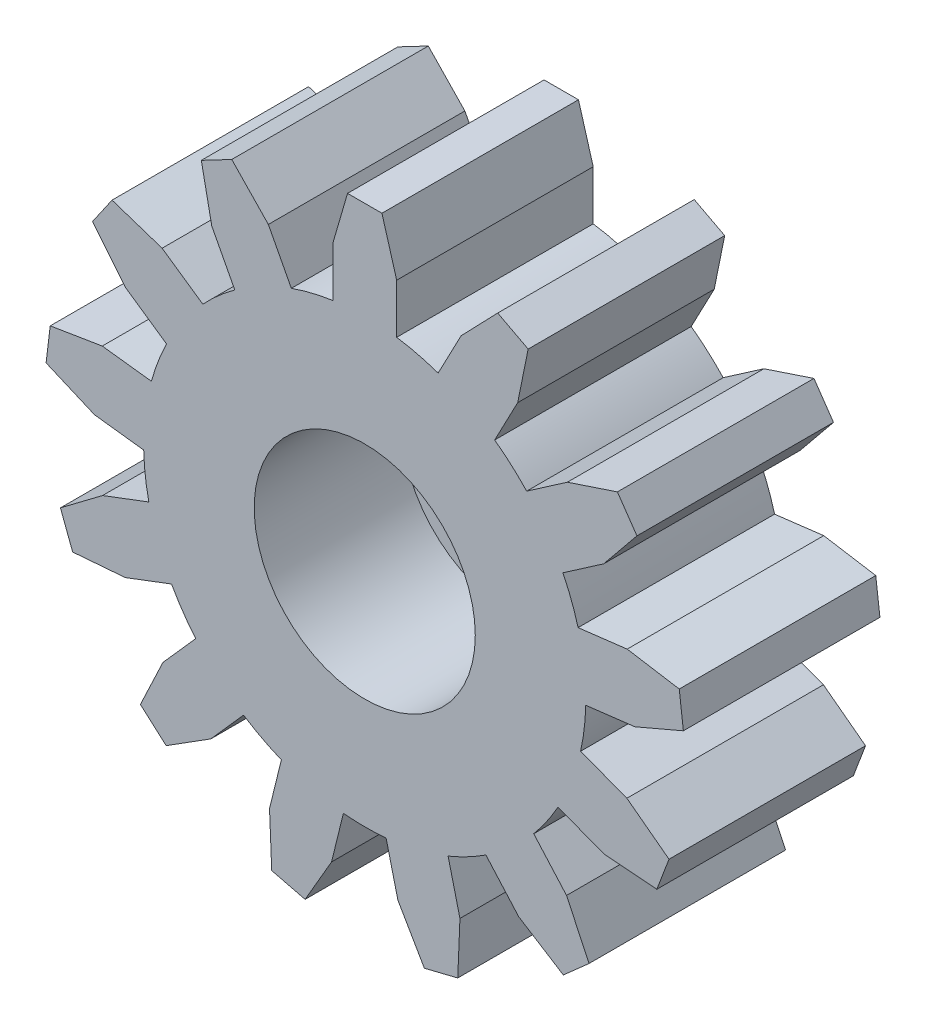
from build123d import *

# Parameters (mm, degrees)
SZKIC1_R                    = 2.25
DODANIE_WYCI_GNI_CIE1_DEPTH = 4
SZKIC1_3_R                  = 2.25
SZKIC1_3_R_2                = 1
DODANIE_WYCI_GNI_CIE2_DEPTH = 1


with BuildPart() as part:
    # Szkic1 → Dodanie-wyciągnięcie1 (new body)
    with BuildSketch(Plane.XY):
        with BuildLine():
            Line((-0.35, 6.490570083), (-0.65, 5.460113222))
            Line((-0.65, 5.460113222), (-0.65, 4.452808103))
            ThreePointArc((-0.65, 4.452808103), (-1.076920489, 4.369238178), (-1.493776689, 4.244835827))
            Line((-1.493776689, 4.244835827), (-1.96189472, 5.136760215))
            Line((-1.96189472, 5.136760215), (-2.706408708, 5.9097675))
            Line((-2.706408708, 5.9097675), (-3.326227926, 5.58446128))
            Line((-3.326227926, 5.58446128), (-3.112987553, 4.532620091))
            Line((-3.112987553, 4.532620091), (-2.644869523, 3.640695704))
            ThreePointArc((-2.644869523, 3.640695704), (-2.984051962, 3.368298367), (-3.295347141, 3.06442282))
            Line((-3.295347141, 3.06442282), (-4.124343002, 3.636637347))
            Line((-4.124343002, 3.636637347), (-5.142811797, 3.975108403))
            Line((-5.142811797, 3.975108403), (-5.54045712, 3.399019697))
            Line((-5.54045712, 3.399019697), (-4.862827173, 2.566758322))
            Line((-4.862827173, 2.566758322), (-4.033831312, 1.994543794))
            ThreePointArc((-4.033831312, 1.994543794), (-4.207573092, 1.595721992), (-4.341993276, 1.181987475))
            Line((-4.341993276, 1.181987475), (-5.341954007, 1.30340469))
            Line((-5.341954007, 1.30340469), (-6.401058681, 1.129799877))
            Line((-6.401058681, 1.129799877), (-6.485434357, 0.434903665))
            Line((-6.485434357, 0.434903665), (-5.498651691, 0.012883153))
            Line((-5.498651691, 0.012883153), (-4.49869096, -0.108534062))
            ThreePointArc((-4.49869096, -0.108534062), (-4.467189933, -0.542415061), (-4.393941078, -0.971226957))
            Line((-4.393941078, -0.971226957), (-5.335787726, -1.328422275))
            Line((-5.335787726, -1.328422275), (-6.192900162, -1.974332186))
            Line((-6.192900162, -1.974332186), (-5.944676741, -2.628843556))
            Line((-5.944676741, -2.628843556), (-4.874801373, -2.54394339))
            Line((-4.874801373, -2.54394339), (-3.932954725, -2.186748072))
            ThreePointArc((-3.932954725, -2.186748072), (-3.703427397, -2.55629136), (-3.439289932, -2.901944997))
            Line((-3.439289932, -2.901944997), (-4.10725678, -3.655923705))
            Line((-4.10725678, -3.655923705), (-4.566022849, -4.626168538))
            Line((-4.566022849, -4.626168538), (-4.042065325, -5.090354399))
            Line((-4.042065325, -5.090354399), (-3.134192808, -4.517983161))
            Line((-3.134192808, -4.517983161), (-2.466225959, -3.764004452))
            ThreePointArc((-2.466225959, -3.764004452), (-2.091254274, -3.984552115), (-1.69673891, -4.16786241))
            Line((-1.69673891, -4.16786241), (-1.937802804, -5.145897073))
            Line((-1.937802804, -5.145897073), (-1.893124727, -6.21820543))
            Line((-1.893124727, -6.21820543), (-1.213465455, -6.385726395))
            Line((-1.213465455, -6.385726395), (-0.675578441, -5.457007437))
            Line((-0.675578441, -5.457007437), (-0.434514548, -4.478972774))
            ThreePointArc((-0.434514548, -4.478972774), (0, -4.5), (0.434514548, -4.478972774))
            Line((0.434514548, -4.478972774), (0.675578441, -5.457007437))
            Line((0.675578441, -5.457007437), (1.213465455, -6.385726395))
            Line((1.213465455, -6.385726395), (1.893124727, -6.21820543))
            Line((1.893124727, -6.21820543), (1.937802804, -5.145897073))
            Line((1.937802804, -5.145897073), (1.69673891, -4.16786241))
            ThreePointArc((1.69673891, -4.16786241), (2.091254274, -3.984552115), (2.466225959, -3.764004452))
            Line((2.466225959, -3.764004452), (3.134192808, -4.517983161))
            Line((3.134192808, -4.517983161), (4.042065325, -5.090354399))
            Line((4.042065325, -5.090354399), (4.566022849, -4.626168538))
            Line((4.566022849, -4.626168538), (4.10725678, -3.655923705))
            Line((4.10725678, -3.655923705), (3.439289932, -2.901944997))
            ThreePointArc((3.439289932, -2.901944997), (3.703427397, -2.55629136), (3.932954725, -2.186748072))
            Line((3.932954725, -2.186748072), (4.874801373, -2.54394339))
            Line((4.874801373, -2.54394339), (5.944676741, -2.628843556))
            Line((5.944676741, -2.628843556), (6.192900162, -1.974332186))
            Line((6.192900162, -1.974332186), (5.335787726, -1.328422275))
            Line((5.335787726, -1.328422275), (4.393941078, -0.971226957))
            ThreePointArc((4.393941078, -0.971226957), (4.467189933, -0.542415061), (4.49869096, -0.108534062))
            Line((4.49869096, -0.108534062), (5.498651691, 0.012883153))
            Line((5.498651691, 0.012883153), (6.485434357, 0.434903665))
            Line((6.485434357, 0.434903665), (6.401058681, 1.129799877))
            Line((6.401058681, 1.129799877), (5.341954007, 1.30340469))
            Line((5.341954007, 1.30340469), (4.341993276, 1.181987475))
            ThreePointArc((4.341993276, 1.181987475), (4.207573092, 1.595721992), (4.033831312, 1.994543794))
            Line((4.033831312, 1.994543794), (4.862827173, 2.566758322))
            Line((4.862827173, 2.566758322), (5.54045712, 3.399019697))
            Line((5.54045712, 3.399019697), (5.142811797, 3.975108403))
            Line((5.142811797, 3.975108403), (4.124343002, 3.636637347))
            Line((4.124343002, 3.636637347), (3.295347141, 3.06442282))
            ThreePointArc((3.295347141, 3.06442282), (2.984051962, 3.368298367), (2.644869523, 3.640695704))
            Line((2.644869523, 3.640695704), (3.112987553, 4.532620091))
            Line((3.112987553, 4.532620091), (3.326227926, 5.58446128))
            Line((3.326227926, 5.58446128), (2.706408708, 5.9097675))
            Line((2.706408708, 5.9097675), (1.96189472, 5.136760215))
            Line((1.96189472, 5.136760215), (1.493776689, 4.244835827))
            ThreePointArc((1.493776689, 4.244835827), (1.076920489, 4.369238178), (0.65, 4.452808103))
            Line((0.65, 4.452808103), (0.65, 5.460113222))
            Line((0.65, 5.460113222), (0.35, 6.490570083))
            Line((0.35, 6.490570083), (-0.35, 6.490570083))
        make_face()
        Circle(SZKIC1_R, mode=Mode.SUBTRACT)
    extrude(amount=DODANIE_WYCI_GNI_CIE1_DEPTH)

    # Szkic1<3> → Dodanie-wyciągnięcie2 (add)
    with BuildSketch(Plane.XY):
        Circle(SZKIC1_3_R)
        Circle(SZKIC1_3_R_2, mode=Mode.SUBTRACT)
    extrude(amount=DODANIE_WYCI_GNI_CIE2_DEPTH)


solid = part.part
